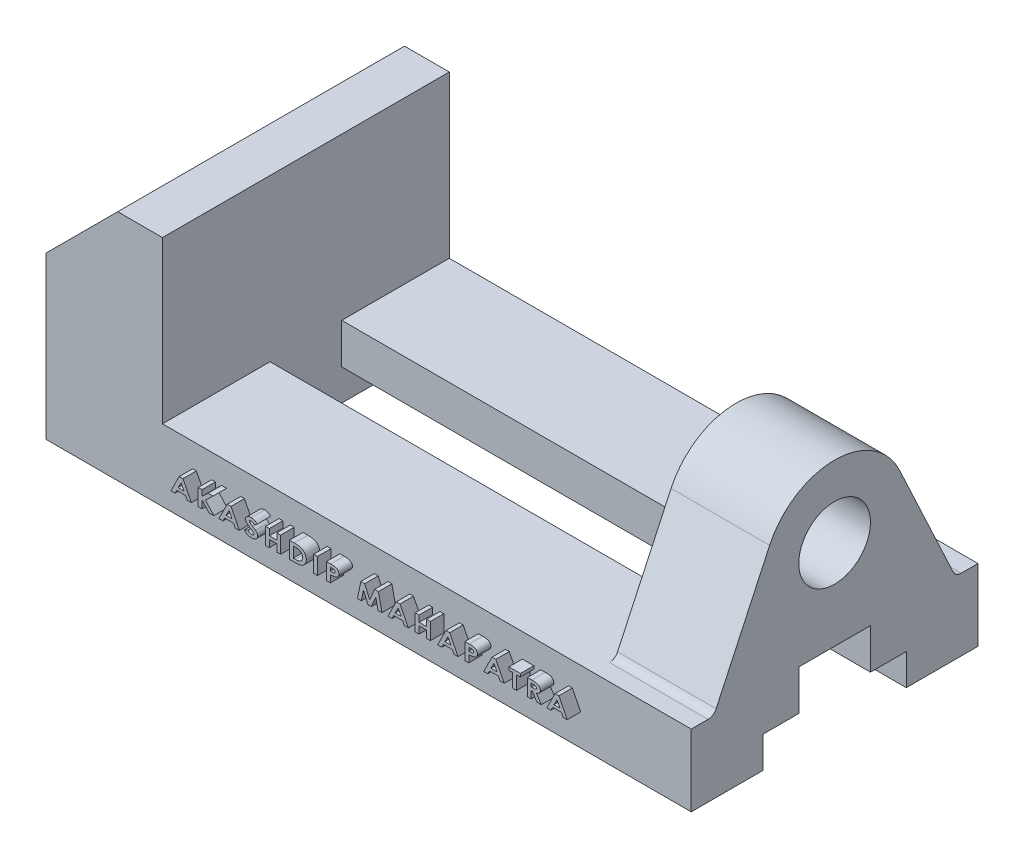
from build123d import *

# Parameters (mm, degrees)
BOSS_EXTRUDE1_DEPTH   = 144
BOSS_EXTRUDE1_2_DEPTH = 144
BOSS_EXTRUDE2_START   = 122
SKETCH1_3_R           = 8
BOSS_EXTRUDE2_DEPTH   = 22
SKETCH1_4_R           = 8
SKETCH1_4_W           = 16
SKETCH1_4_H           = 9
BOSS_EXTRUDE3_DEPTH   = 26
CHAMFER1_SIZE         = 16
FILLET1_R             = 2
LPATTERN1_COUNT       = 2
LPATTERN1_PITCH       = 70
LPATTERN1_COUNT_DIR2  = 2
LPATTERN1_PITCH_DIR2  = 44
WRAP1_OUTLINE_W       = 0.854807692
WRAP1_OUTLINE_H       = 3.704166667
WRAP1_DEPTH           = 3


# Read off the part's stored shape, not the designer's step: Wrap1
with BuildPart() as part:
    # Sketch1 → Boss-Extrude1 (new body)
    with BuildSketch(Plane(origin=(0, 0, 0), x_dir=(0, 0, -1), z_dir=(1, 0, 0))):
        Polygon((26.980199866, -10), (8, -10), (8, -19), (16, -19), (16, -26), (32, -26), (32, -10), align=None)
    extrude(amount=BOSS_EXTRUDE1_DEPTH)



with BuildPart() as body_2:
    # Sketch1 → Boss-Extrude1 2 (new body)
    with BuildSketch(Plane(origin=(0, 0, 0), x_dir=(0, 0, -1), z_dir=(1, 0, 0))):
        Polygon((-8, -10), (-26.980199866, -10), (-32, -10), (-32, -26), (-16, -26), (-16, -19), (-8, -19), align=None)
    extrude(amount=BOSS_EXTRUDE1_2_DEPTH)


with BuildPart() as part_1:
    add(part.part)

    add(body_2.part)  # Boss-Extrude2 merges body 2
    # Sketch1<3> → Boss-Extrude2 (add)
    with BuildSketch(Plane(origin=(0, 0, 0), x_dir=(0, 0, -1), z_dir=(1, 0, 0)).offset(BOSS_EXTRUDE2_START)):
        with BuildLine():
            Line((-14.500924593, 16.761892188), (-26.980199866, -10))
            Line((-26.980199866, -10), (-8, -10))
            Line((-8, -10), (8, -10))
            Line((8, -10), (26.980199866, -10))
            Line((26.980199866, -10), (14.500924593, 16.761892188))
            ThreePointArc((14.500924593, 16.761892188), (8.596793749, 23.494263123), (3.7e-08, 26))
            ThreePointArc((3.7e-08, 26), (-8.596793718, 23.494263143), (-14.500924593, 16.761892188))
        make_face()
        with Locations((0, 10)):
            Circle(SKETCH1_3_R, mode=Mode.SUBTRACT)
    extrude(amount=BOSS_EXTRUDE2_DEPTH)

    # Sketch1<4> → Boss-Extrude3 (add)
    # profile 1 of 6: a face of its own
    with BuildSketch(Plane(origin=(0, 0, 0), x_dir=(0, 0, -1), z_dir=(1, 0, 0))):
        with BuildLine():
            Line((-14.500924593, 16.761892188), (-26.980199866, -10))
            Line((-26.980199866, -10), (-8, -10))
            Line((-8, -10), (8, -10))
            Line((8, -10), (26.980199866, -10))
            Line((26.980199866, -10), (14.500924593, 16.761892188))
            ThreePointArc((14.500924593, 16.761892188), (8.596793749, 23.494263123), (3.7e-08, 26))
            ThreePointArc((3.7e-08, 26), (-8.596793718, 23.494263143), (-14.500924593, 16.761892188))
        make_face()
        with Locations((0, 10)):
            Circle(SKETCH1_4_R, mode=Mode.SUBTRACT)
    # profile 2 of 6: a face of its own
    with BuildSketch(Plane(origin=(0, 0, 0), x_dir=(0, 0, -1), z_dir=(1, 0, 0))):
        with BuildLine():
            Line((32, 26), (3.7e-08, 26))
            ThreePointArc((3.7e-08, 26), (8.596793749, 23.494263123), (14.500924593, 16.761892188))
            Line((14.500924593, 16.761892188), (26.980199866, -10))
            Line((26.980199866, -10), (32, -10))
            Line((32, -10), (32, 26))
        make_face()
    # profile 3 of 6: a face of its own
    with BuildSketch(Plane(origin=(0, 0, 0), x_dir=(0, 0, -1), z_dir=(1, 0, 0))):
        with BuildLine():
            Line((-32, -10), (-26.980199866, -10))
            Line((-26.980199866, -10), (-14.500924593, 16.761892188))
            ThreePointArc((-14.500924593, 16.761892188), (-8.596793718, 23.494263143), (3.7e-08, 26))
            Line((3.7e-08, 26), (-32, 26))
            Line((-32, 26), (-32, -10))
        make_face()
    # profile 4 of 6: a face of its own
    with BuildSketch(Plane(origin=(0, 0, 0), x_dir=(0, 0, -1), z_dir=(1, 0, 0))):
        with Locations((0, -14.5)):
            Rectangle(SKETCH1_4_W, SKETCH1_4_H)
    # profile 5 of 6: a face of its own
    with BuildSketch(Plane(origin=(0, 0, 0), x_dir=(0, 0, -1), z_dir=(1, 0, 0))):
        Polygon((8, -19), (-8, -19), (-16, -19), (-16, -26), (16, -26), (16, -19), align=None)
    # profile 6 of 6: a face of its own
    with BuildSketch(Plane(origin=(0, 0, 0), x_dir=(0, 0, -1), z_dir=(1, 0, 0))):
        with Locations((0, 10)):
            Circle(SKETCH1_4_R)
    extrude(amount=BOSS_EXTRUDE3_DEPTH)

    # Chamfer1
    chamfer1_edges = [part_1.edges().sort_by_distance(p)[0] for p in [
        (0, 26, 0),
    ]]
    chamfer(chamfer1_edges, length=CHAMFER1_SIZE)

    # Fillet1
    fillet1_edges = [part_1.edges().sort_by_distance(p)[0] for p in [
        (133, -10, 26.980199866),
        (133, -10, -26.980199866),
    ]]
    fillet(fillet1_edges, radius=FILLET1_R)

    # Sketch4 → M6x1.0 Tapped Hole1 (revolve, cut)
    with BuildSketch(Plane(origin=(106, -26, -22), x_dir=(0, 0, -1), z_dir=(1, 0, 0))):
        Polygon((0, 0), (0, 11.502151548), (2.5, 10), (2.5, 0), align=None)
    m6x1_0_tapped_hole1 = revolve(axis=Axis((106, -32.35, -22), (0, 1, 0)), mode=Mode.SUBTRACT)

    # LPattern1: M6x1.0 Tapped Hole1 2 × 2
    with Locations(*[(-i * LPATTERN1_PITCH, 0, j * LPATTERN1_PITCH_DIR2) for i in range(LPATTERN1_COUNT) for j in range(LPATTERN1_COUNT_DIR2) if (i, j) != (0, 0)]):
        add(m6x1_0_tapped_hole1, mode=Mode.SUBTRACT)

    # Wrap1 outline → Wrap1 (add)
    # profile 1 of 17: a face of its own
    with BuildSketch(Plane.XY.offset(32)):
        with BuildLine():
            add(Edge.make_bspline(
                [(49.491506657, -16.264982993), (49.462997763, -16.234870068), (49.407860805, -16.176630871), (49.32066963, -16.098994351), (49.233060059, -16.033396076), (49.145100444, -15.979243306), (49.056323415, -15.93715398), (48.966896606, -15.907381505), (48.877156949, -15.888558524), (48.817097644, -15.886225053), (48.78732914, -15.885068463)],
                knots=[0, 0, 0, 0, 0.150958661, 0.291958057, 0.424544558, 0.549052631, 0.667513603, 0.781446696, 0.891673652, 1, 1, 1, 1], degree=3))
            Line((49.491506657, -16.264982993), (50.148194858, -15.810124386))
            add(Edge.make_bspline(
                [(48.808847736, -15.220218036), (48.866067551, -15.221805712), (48.979518078, -15.224953621), (49.147237251, -15.24957773), (49.310849741, -15.288786777), (49.443865549, -15.335548015), (49.549569543, -15.381723413), (49.630556802, -15.423451949), (49.712791292, -15.472256023), (49.797748493, -15.525811035), (49.88270271, -15.588317012), (49.970503006, -15.655530806), (50.059585754, -15.72983719), (50.118206643, -15.782952576), (50.148194858, -15.810124386)],
                knots=[0, 0, 0, 0, 0.114222249, 0.226470051, 0.337758597, 0.449758371, 0.507480247, 0.56800576, 0.631537887, 0.698398273, 0.768446333, 0.842045394, 0.919196437, 1, 1, 1, 1], degree=3))
            add(Edge.make_bspline(
                [(47.536282465, -16.159616073), (47.537427776, -16.127871672), (47.539690554, -16.065154595), (47.557639617, -15.973000873), (47.585345569, -15.883779472), (47.627182847, -15.799142244), (47.678722518, -15.717199356), (47.742344732, -15.639358926), (47.817084743, -15.564685132), (47.902743374, -15.495192342), (47.996379927, -15.430875604), (48.096639203, -15.374358844), (48.202604143, -15.326931952), (48.313409152, -15.287341456), (48.42962162, -15.256981232), (48.551201012, -15.235506683), (48.678230835, -15.222873013), (48.764792765, -15.221113517), (48.808847736, -15.220218036)],
                knots=[0, 0, 0, 0, 0.054345475, 0.107369781, 0.16030427, 0.213939686, 0.268604717, 0.325849812, 0.385776716, 0.449311953, 0.514544253, 0.580192255, 0.646193517, 0.713207231, 0.781556748, 0.85171219, 0.924530159, 1, 1, 1, 1], degree=3))
            add(Edge.make_bspline(
                [(48.749486091, -17.459636105), (48.688268321, -17.419756242), (48.570948332, -17.343329003), (48.404478555, -17.230604169), (48.255157277, -17.124651783), (48.123020407, -17.025421754), (48.007842617, -16.933222941), (47.90853841, -16.849449876), (47.827426003, -16.771235707), (47.760701363, -16.699526241), (47.707342786, -16.630343856), (47.66109651, -16.563431366), (47.623867053, -16.495528188), (47.590979729, -16.428700477), (47.566638882, -16.361204809), (47.549489142, -16.293840711), (47.538603713, -16.226749794), (47.537053524, -16.181916165), (47.536282465, -16.159616073)],
                knots=[0, 0, 0, 0, 0.118699559, 0.22748021, 0.326606583, 0.416137866, 0.495902898, 0.566294685, 0.627112883, 0.678877674, 0.725259051, 0.768949452, 0.810868681, 0.850950612, 0.889848742, 0.927177123, 0.963778152, 1, 1, 1, 1], degree=3))
            add(Edge.make_bspline(
                [(49.388365798, -18.098515812), (49.386889247, -18.077297144), (49.383857602, -18.033731127), (49.359487509, -17.969679139), (49.322481421, -17.90561504), (49.278980477, -17.853624814), (49.234263771, -17.810571707), (49.191711335, -17.772371657), (49.139825225, -17.730462461), (49.078704715, -17.684525583), (49.008962804, -17.63438484), (48.931056405, -17.578978177), (48.843272163, -17.520777769), (48.781667969, -17.480616338), (48.749486091, -17.459636105)],
                knots=[0, 0, 0, 0, 0.067943983, 0.139502096, 0.217390018, 0.304805441, 0.355891195, 0.416610267, 0.488273987, 0.569884028, 0.661986168, 0.763963189, 0.876694953, 1, 1, 1, 1], degree=3))
            add(Edge.make_bspline(
                [(48.84075462, -18.44949154), (48.877962833, -18.448328012), (48.949989021, -18.446075699), (49.053074065, -18.425411341), (49.147590374, -18.393396805), (49.229496605, -18.34647859), (49.29867668, -18.293010934), (49.350007578, -18.233102242), (49.382956482, -18.167580192), (49.386575789, -18.121370067), (49.388365798, -18.098515812)],
                knots=[0, 0, 0, 0, 0.156372757, 0.302700202, 0.440600159, 0.574322046, 0.697997564, 0.806585982, 0.904342756, 1, 1, 1, 1], degree=3))
            add(Edge.make_bspline(
                [(48.055696861, -17.974598378), (48.083913987, -18.012296853), (48.138575211, -18.085325013), (48.229729795, -18.181584957), (48.32267907, -18.264897893), (48.420229933, -18.331623315), (48.520567047, -18.38481008), (48.624506388, -18.421942382), (48.73163001, -18.445294387), (48.804278515, -18.448088596), (48.84075462, -18.44949154)],
                knots=[0, 0, 0, 0, 0.14789083, 0.286488915, 0.415934943, 0.539495035, 0.657026207, 0.771865439, 0.885455863, 1, 1, 1, 1], degree=3))
            Line((48.055696861, -17.974598378), (47.298835884, -18.325574106))
            add(Edge.make_bspline(
                [(48.805879654, -19.114341968), (48.764804487, -19.113793708), (48.684039126, -19.112715674), (48.564900054, -19.103556383), (48.449708762, -19.088833498), (48.338425116, -19.068193389), (48.231147288, -19.041366039), (48.127963297, -19.008893098), (48.028878507, -18.970058986), (47.933482975, -18.925593713), (47.841968161, -18.874237284), (47.754117381, -18.815964451), (47.669424865, -18.751454756), (47.588125082, -18.679763879), (47.510580484, -18.601162688), (47.435914634, -18.516011262), (47.364558788, -18.424223406), (47.320941676, -18.358754638), (47.298835884, -18.325574106)],
                knots=[0, 0, 0, 0, 0.069079596, 0.135829965, 0.200847866, 0.264328967, 0.326079771, 0.386734776, 0.44614432, 0.50495509, 0.563627381, 0.622473456, 0.682133011, 0.742559312, 0.804630205, 0.867717485, 0.932957279, 1, 1, 1, 1], degree=3))
            add(Edge.make_bspline(
                [(50.243173491, -18.059930743), (50.242220416, -18.097374237), (50.240345046, -18.171051989), (50.219871235, -18.27880867), (50.189055718, -18.381532176), (50.145564976, -18.479540121), (50.088283416, -18.571612339), (50.020057634, -18.659841616), (49.937863509, -18.741672854), (49.845013605, -18.818276795), (49.741923514, -18.8878857), (49.63041452, -18.948821359), (49.511328386, -18.999942168), (49.384691456, -19.041768729), (49.250595902, -19.073943693), (49.109071775, -19.097769591), (48.96002295, -19.112100781), (48.858100636, -19.113582694), (48.805879654, -19.114341968)],
                knots=[0, 0, 0, 0, 0.056434847, 0.111047135, 0.164883648, 0.218011755, 0.272291459, 0.328134543, 0.385930226, 0.446905296, 0.509531335, 0.573332937, 0.63836384, 0.704810145, 0.774329817, 0.846239791, 0.92121932, 1, 1, 1, 1], degree=3))
            add(Edge.make_bspline(
                [(49.745277691, -17.210317195), (49.787636114, -17.24555363), (49.868329302, -17.312679363), (49.974659465, -17.418073071), (50.062263707, -17.52075547), (50.130640935, -17.623002032), (50.181267747, -17.726758905), (50.217785173, -17.833538722), (50.238553429, -17.94534847), (50.24162439, -18.021511455), (50.243173491, -18.059930743)],
                knots=[0, 0, 0, 0, 0.161610153, 0.307868829, 0.438705892, 0.557063796, 0.667745359, 0.776530934, 0.887274346, 1, 1, 1, 1], degree=3))
            add(Edge.make_bspline(
                [(49.125690518, -16.782913348), (49.16628074, -16.809833699), (49.243116461, -16.86079288), (49.351906997, -16.933819988), (49.448022609, -16.999017054), (49.532173251, -17.055963982), (49.603168438, -17.105781168), (49.662093794, -17.14716014), (49.708061738, -17.181127744), (49.734182347, -17.201614825), (49.745277691, -17.210317195)],
                knots=[0, 0, 0, 0, 0.194085623, 0.367396574, 0.522122062, 0.656895355, 0.772279406, 0.867721118, 0.943811435, 1, 1, 1, 1], degree=3))
            add(Edge.make_bspline(
                [(48.471228378, -16.305052104), (48.482470293, -16.31584161), (48.508547651, -16.340869536), (48.557066966, -16.379563512), (48.617497289, -16.428483512), (48.693550957, -16.48295167), (48.781607911, -16.547543131), (48.884612484, -16.618075788), (48.999893065, -16.69876769), (49.082296273, -16.753887027), (49.125690518, -16.782913348)],
                knots=[0, 0, 0, 0, 0.057608318, 0.133631395, 0.229362006, 0.345190875, 0.479516157, 0.633313801, 0.806899863, 1, 1, 1, 1], degree=3))
            add(Edge.make_bspline(
                [(48.391090157, -16.127709189), (48.392173174, -16.143156908), (48.394370471, -16.174498272), (48.410063292, -16.220559984), (48.435787516, -16.264974602), (48.459098266, -16.29133504), (48.471228378, -16.305052104)],
                knots=[0, 0, 0, 0, 0.232325279, 0.471357019, 0.724912389, 1, 1, 1, 1], degree=3))
            add(Edge.make_bspline(
                [(48.78732914, -15.885068463), (48.759564918, -15.885800625), (48.706117316, -15.887210074), (48.629790578, -15.901342709), (48.561422867, -15.925084644), (48.502242662, -15.957320243), (48.454518084, -15.995530664), (48.417544873, -16.035894239), (48.395096226, -16.080896189), (48.392399698, -16.112406523), (48.391090157, -16.127709189)],
                knots=[0, 0, 0, 0, 0.163624331, 0.314985536, 0.455708752, 0.58890329, 0.710338001, 0.814775027, 0.910047421, 1, 1, 1, 1], degree=3))
        make_face()
    # profile 2 of 17: a face of its own
    with BuildSketch(Plane.XY.offset(32)):
        with BuildLine():
            add(Edge.make_bspline(
                [(58.414600774, -15.315196668), (58.497965261, -15.31565234), (58.659065735, -15.316532917), (58.892404317, -15.326476109), (59.108959167, -15.341697157), (59.309043507, -15.362810971), (59.492611177, -15.390639939), (59.659810648, -15.425380596), (59.810664094, -15.465653785), (59.946745765, -15.512730248), (60.07092012, -15.568331874), (60.188630066, -15.629522295), (60.300084517, -15.699860075), (60.406695137, -15.777121217), (60.507783101, -15.862543351), (60.602793376, -15.956275845), (60.691946687, -16.057704329), (60.775784857, -16.165615133), (60.851969407, -16.279875465), (60.918540432, -16.399871333), (60.973864701, -16.525008148), (61.02074416, -16.654407659), (61.05468125, -16.789359717), (61.081419437, -16.928206804), (61.096079253, -17.072233014), (61.098169775, -17.169723286), (61.099231183, -17.219221441)],
                knots=[0, 0, 0, 0, 0.066843146, 0.12917326, 0.18723626, 0.240897148, 0.290461912, 0.336050185, 0.37776348, 0.415587011, 0.451371808, 0.486769224, 0.521878201, 0.55694738, 0.592271376, 0.627894219, 0.663866496, 0.700483098, 0.73739341, 0.773879254, 0.810368872, 0.847004268, 0.88409319, 0.921825612, 0.960308983, 1, 1, 1, 1], degree=3))
            Line((58.414600774, -15.315196668), (57.3475752, -15.315196668))
            Line((57.3475752, -15.315196668), (57.3475752, -19.019363335))
            Line((57.3475752, -19.019363335), (58.430925227, -19.019363335))
            add(Edge.make_bspline(
                [(61.099231183, -17.219221441), (61.098612157, -17.254605859), (61.097389774, -17.324478964), (61.089115549, -17.428305507), (61.075089709, -17.529902375), (61.055099609, -17.629548675), (61.028889627, -17.726801656), (60.997765975, -17.822300416), (60.960693717, -17.915409234), (60.918430839, -18.00615287), (60.870676762, -18.093607065), (60.819213914, -18.178200835), (60.762339381, -18.258276152), (60.702303304, -18.335356193), (60.637047161, -18.407703107), (60.567440298, -18.476299112), (60.494351884, -18.541791504), (60.390573442, -18.622116531), (60.255173222, -18.71273614), (60.084663052, -18.804678989), (59.90712631, -18.877829926), (59.751439666, -18.923654172), (59.616057729, -18.952598926), (59.496960871, -18.969385444), (59.361166235, -18.985205338), (59.208173759, -18.997136807), (59.038018371, -19.00800961), (58.8506901, -19.013804484), (58.646384229, -19.018695397), (58.504636381, -19.019134825), (58.430925227, -19.019363335)],
                knots=[0, 0, 0, 0, 0.028928171, 0.057124046, 0.085092767, 0.11273427, 0.14015372, 0.167395124, 0.194807116, 0.22203726, 0.249182426, 0.276234035, 0.302938774, 0.329435991, 0.356070201, 0.382523399, 0.409308408, 0.436248684, 0.489753398, 0.542317841, 0.594365535, 0.646448572, 0.674766006, 0.7074825, 0.744730849, 0.786528911, 0.832922789, 0.884115749, 0.939738331, 1, 1, 1, 1], degree=3))
        make_face()
        with BuildLine():
            add(Edge.make_bspline(
                [(58.640917047, -18.354512908), (58.693116337, -18.354431413), (58.793842262, -18.354274158), (58.939256678, -18.347375841), (59.073756576, -18.34041116), (59.196897031, -18.327136833), (59.309078965, -18.312721996), (59.409547148, -18.29175727), (59.499789994, -18.270764794), (59.579654338, -18.243264985), (59.652595352, -18.212312786), (59.720717451, -18.176648804), (59.78580367, -18.136377358), (59.847292941, -18.091158099), (59.905315575, -18.041035043), (59.960610835, -17.986950894), (60.011850859, -17.92708828), (60.059678481, -17.862896788), (60.104168109, -17.79492374), (60.140627778, -17.721750597), (60.172986602, -17.645550055), (60.199844161, -17.56554851), (60.21969484, -17.48128665), (60.233534163, -17.393210697), (60.242814494, -17.301535316), (60.243882251, -17.239031761), (60.244423491, -17.207349112)],
                knots=[0, 0, 0, 0, 0.069208905, 0.133548384, 0.193024024, 0.247755054, 0.297758134, 0.342913613, 0.383801954, 0.420519209, 0.454757611, 0.48879275, 0.522377663, 0.55616218, 0.589887736, 0.6239813, 0.658631964, 0.69425169, 0.730098712, 0.766183526, 0.802489762, 0.839828748, 0.877934867, 0.917136137, 0.957996843, 1, 1, 1, 1], degree=3))
            Line((58.640917047, -18.354512908), (58.202382892, -18.354512908))
            Line((58.202382892, -18.354512908), (58.202382892, -15.980047096))
            Line((58.202382892, -15.980047096), (58.522935777, -15.980047096))
            add(Edge.make_bspline(
                [(59.802179233, -16.276855322), (59.767132116, -16.252645785), (59.694623916, -16.202559211), (59.570496251, -16.143835162), (59.432838303, -16.092323787), (59.279640439, -16.051404937), (59.111807281, -16.018843736), (58.928806383, -15.996642815), (58.730937295, -15.982120016), (58.593950593, -15.980754822), (58.522935777, -15.980047096)],
                knots=[0, 0, 0, 0, 0.095660318, 0.197909504, 0.307745783, 0.425960963, 0.554040151, 0.69196668, 0.840313481, 1, 1, 1, 1], degree=3))
            add(Edge.make_bspline(
                [(60.244423491, -17.207349112), (60.243258328, -17.158794173), (60.240982041, -17.063936161), (60.219776538, -16.925759195), (60.184830858, -16.795880473), (60.136737466, -16.673967754), (60.073867384, -16.5611107), (59.997016465, -16.457040264), (59.907334191, -16.360187822), (59.83759226, -16.304919202), (59.802179233, -16.276855322)],
                knots=[0, 0, 0, 0, 0.135919198, 0.26553478, 0.390390601, 0.511953322, 0.631652301, 0.751086387, 0.873608539, 1, 1, 1, 1], degree=3))
        make_face(mode=Mode.SUBTRACT)
    # profile 3 of 17: a face of its own
    with BuildSketch(Plane.XY.offset(32)):
        with BuildLine():
            add(Edge.make_bspline(
                [(66.543732886, -15.315196668), (66.605818493, -15.315411368), (66.725561527, -15.315825454), (66.898514621, -15.320937882), (67.058071376, -15.329963684), (67.204146054, -15.341234689), (67.336749193, -15.357061417), (67.455977476, -15.374952561), (67.561846885, -15.396968836), (67.655526804, -15.423183182), (67.739971686, -15.453740103), (67.819300799, -15.486605341), (67.893013121, -15.525816486), (67.963680146, -15.56695381), (68.02864752, -15.613831754), (68.089276538, -15.664807038), (68.145827475, -15.719422158), (68.196968417, -15.778974661), (68.242750656, -15.841822588), (68.283443698, -15.90757373), (68.317412692, -15.976758567), (68.345859434, -16.048857406), (68.367516577, -16.124150616), (68.381834891, -16.202739997), (68.39217895, -16.284002813), (68.393116536, -16.339398654), (68.393590157, -16.367381831)],
                knots=[0, 0, 0, 0, 0.077296154, 0.149079252, 0.215390048, 0.276254581, 0.33144859, 0.381621573, 0.426314706, 0.465991585, 0.502614802, 0.538076418, 0.572785299, 0.606479389, 0.63980702, 0.672374816, 0.70504001, 0.737572846, 0.769971321, 0.8017656, 0.833716081, 0.865796887, 0.898155824, 0.931071174, 0.965180643, 1, 1, 1, 1], degree=3))
            Line((66.543732886, -15.315196668), (65.591720499, -15.315196668))
            Line((65.591720499, -15.315196668), (65.591720499, -19.019363335))
            Line((65.591720499, -19.019363335), (66.446528191, -19.019363335))
            Line((66.446528191, -19.019363335), (66.446528191, -17.404726583))
            add(Edge.make_bspline(
                [(67.413380989, -17.34833302), (67.388938799, -17.353062207), (67.335843708, -17.363335289), (67.24878372, -17.373626757), (67.148347885, -17.383296405), (67.034296607, -17.39144121), (66.906615639, -17.397010331), (66.765373159, -17.401402658), (66.610528687, -17.404552885), (66.502676121, -17.404667115), (66.446528191, -17.404726583)],
                knots=[0, 0, 0, 0, 0.076992595, 0.167248878, 0.271023112, 0.389157746, 0.520907297, 0.666359895, 0.826307321, 1, 1, 1, 1], degree=3))
            add(Edge.make_bspline(
                [(68.393590157, -16.367381831), (68.392620472, -16.39833091), (68.390712732, -16.459219568), (68.379075148, -16.548598159), (68.357987438, -16.633802407), (68.328970162, -16.715136111), (68.291812687, -16.792573525), (68.246116418, -16.866039637), (68.191741375, -16.934842128), (68.129669965, -16.999697207), (68.060945771, -17.059978752), (67.986341571, -17.116294342), (67.905021236, -17.166481254), (67.818164184, -17.212366587), (67.725574845, -17.254256983), (67.627133525, -17.291012612), (67.52267086, -17.323442504), (67.450360379, -17.339911049), (67.413380989, -17.34833302)],
                knots=[0, 0, 0, 0, 0.061452874, 0.120901275, 0.178545667, 0.235393938, 0.292059519, 0.348744246, 0.406801297, 0.465846764, 0.526731968, 0.58811417, 0.65120122, 0.716223256, 0.783035972, 0.852809367, 0.924727098, 1, 1, 1, 1], degree=3))
        make_face()
        with BuildLine():
            add(Edge.make_bspline(
                [(66.747788541, -16.739876156), (66.776233167, -16.739675579), (66.830899991, -16.739290096), (66.909570691, -16.737989521), (66.98133699, -16.735213716), (67.046359946, -16.730439486), (67.104594216, -16.725819169), (67.156234236, -16.718737442), (67.201214496, -16.711968179), (67.251335029, -16.70004871), (67.306192928, -16.681806985), (67.364969903, -16.653214054), (67.416683825, -16.61935428), (67.460313674, -16.57872969), (67.495684376, -16.532882893), (67.520400449, -16.481264754), (67.535857968, -16.42540354), (67.537792634, -16.386529101), (67.538782465, -16.366639811)],
                knots=[0, 0, 0, 0, 0.087017856, 0.167236862, 0.240694134, 0.306678908, 0.366688329, 0.419339316, 0.46611096, 0.505753849, 0.576818402, 0.64246828, 0.705215376, 0.765177077, 0.824045101, 0.881235909, 0.939236846, 1, 1, 1, 1], degree=3))
            Line((66.747788541, -16.739876156), (66.446528191, -16.739876156))
            Line((66.446528191, -16.739876156), (66.446528191, -15.980047096))
            Line((66.446528191, -15.980047096), (66.713655595, -15.980047096))
            add(Edge.make_bspline(
                [(67.315434274, -16.053507132), (67.300443825, -16.047534198), (67.268270618, -16.034714807), (67.214222359, -16.02037425), (67.152004136, -16.007966442), (67.081155047, -15.997691894), (67.001680201, -15.98976044), (66.913344227, -15.983686547), (66.816314283, -15.981257218), (66.748778115, -15.980461114), (66.713655595, -15.980047096)],
                knots=[0, 0, 0, 0, 0.079352001, 0.170309001, 0.274627017, 0.391510308, 0.522437574, 0.667611812, 0.82713987, 1, 1, 1, 1], degree=3))
            add(Edge.make_bspline(
                [(67.538782465, -16.366639811), (67.538059733, -16.349270717), (67.536652247, -16.315445245), (67.525985779, -16.266640814), (67.508744853, -16.221228541), (67.484263636, -16.179272525), (67.451593991, -16.142161073), (67.412995087, -16.108224382), (67.367656033, -16.077387233), (67.333266527, -16.061661511), (67.315434274, -16.053507132)],
                knots=[0, 0, 0, 0, 0.127009453, 0.247344791, 0.363638272, 0.481275906, 0.600627337, 0.723721013, 0.856738953, 1, 1, 1, 1], degree=3))
        make_face(mode=Mode.SUBTRACT)
    # profile 4 of 17: a face of its own
    with BuildSketch(Plane.XY.offset(32)):
        with BuildLine():
            add(Edge.make_bspline(
                [(97.449779894, -15.315196668), (97.511865502, -15.315411368), (97.631608535, -15.315825454), (97.804561629, -15.320937882), (97.964118384, -15.329963684), (98.110193062, -15.341234689), (98.242796202, -15.357061417), (98.362024485, -15.374952561), (98.467893893, -15.396968836), (98.561573812, -15.423183182), (98.646018694, -15.453740103), (98.725347808, -15.486605341), (98.799060129, -15.525816486), (98.869727155, -15.56695381), (98.934694529, -15.613831754), (98.995323546, -15.664807038), (99.051874484, -15.719422158), (99.103015426, -15.778974661), (99.148797664, -15.841822588), (99.189490706, -15.90757373), (99.223459701, -15.976758567), (99.251906443, -16.048857406), (99.273563586, -16.124150616), (99.2878819, -16.202739997), (99.298225959, -16.284002813), (99.299163545, -16.339398654), (99.299637166, -16.367381831)],
                knots=[0, 0, 0, 0, 0.077296154, 0.149079252, 0.215390048, 0.276254581, 0.33144859, 0.381621573, 0.426314706, 0.465991585, 0.502614802, 0.538076418, 0.572785299, 0.606479389, 0.63980702, 0.672374816, 0.70504001, 0.737572846, 0.769971321, 0.8017656, 0.833716081, 0.865796887, 0.898155824, 0.931071174, 0.965180643, 1, 1, 1, 1], degree=3))
            Line((97.449779894, -15.315196668), (96.497767508, -15.315196668))
            Line((96.497767508, -15.315196668), (96.497767508, -19.019363335))
            Line((96.497767508, -19.019363335), (97.3525752, -19.019363335))
            Line((97.3525752, -19.019363335), (97.3525752, -17.404726583))
            add(Edge.make_bspline(
                [(98.319427998, -17.34833302), (98.294985808, -17.353062207), (98.241890716, -17.363335289), (98.154830729, -17.373626757), (98.054394893, -17.383296405), (97.940343615, -17.39144121), (97.812662647, -17.397010331), (97.671420168, -17.401402658), (97.516575695, -17.404552885), (97.408723129, -17.404667115), (97.3525752, -17.404726583)],
                knots=[0, 0, 0, 0, 0.076992595, 0.167248878, 0.271023112, 0.389157746, 0.520907297, 0.666359895, 0.826307321, 1, 1, 1, 1], degree=3))
            add(Edge.make_bspline(
                [(99.299637166, -16.367381831), (99.298667481, -16.39833091), (99.29675974, -16.459219568), (99.285122157, -16.548598159), (99.264034447, -16.633802407), (99.23501717, -16.715136111), (99.197859695, -16.792573525), (99.152163427, -16.866039637), (99.097788384, -16.934842128), (99.035716973, -16.999697207), (98.96699278, -17.059978752), (98.892388579, -17.116294342), (98.811068245, -17.166481254), (98.724211193, -17.212366587), (98.631621853, -17.254256983), (98.533180534, -17.291012612), (98.428717869, -17.323442504), (98.356407387, -17.339911049), (98.319427998, -17.34833302)],
                knots=[0, 0, 0, 0, 0.061452874, 0.120901275, 0.178545667, 0.235393938, 0.292059519, 0.348744246, 0.406801297, 0.465846764, 0.526731968, 0.58811417, 0.65120122, 0.716223256, 0.783035972, 0.852809367, 0.924727098, 1, 1, 1, 1], degree=3))
        make_face()
        with BuildLine():
            add(Edge.make_bspline(
                [(97.65383555, -16.739876156), (97.682280175, -16.739675579), (97.736947, -16.739290096), (97.815617699, -16.737989521), (97.887383999, -16.735213716), (97.952406954, -16.730439486), (98.010641225, -16.725819169), (98.062281245, -16.718737442), (98.107261504, -16.711968179), (98.157382037, -16.70004871), (98.212239936, -16.681806985), (98.271016912, -16.653214054), (98.322730833, -16.61935428), (98.366360683, -16.57872969), (98.401731384, -16.532882893), (98.426447457, -16.481264754), (98.441904976, -16.42540354), (98.443839642, -16.386529101), (98.444829473, -16.366639811)],
                knots=[0, 0, 0, 0, 0.087017856, 0.167236862, 0.240694134, 0.306678908, 0.366688329, 0.419339316, 0.46611096, 0.505753849, 0.576818402, 0.64246828, 0.705215376, 0.765177077, 0.824045101, 0.881235909, 0.939236846, 1, 1, 1, 1], degree=3))
            Line((97.65383555, -16.739876156), (97.3525752, -16.739876156))
            Line((97.3525752, -16.739876156), (97.3525752, -15.980047096))
            Line((97.3525752, -15.980047096), (97.619702604, -15.980047096))
            add(Edge.make_bspline(
                [(98.221481283, -16.053507132), (98.206490834, -16.047534198), (98.174317626, -16.034714807), (98.120269368, -16.02037425), (98.058051144, -16.007966442), (97.987202056, -15.997691894), (97.907727209, -15.98976044), (97.819391235, -15.983686547), (97.722361291, -15.981257218), (97.654825124, -15.980461114), (97.619702604, -15.980047096)],
                knots=[0, 0, 0, 0, 0.079352001, 0.170309001, 0.274627017, 0.391510308, 0.522437574, 0.667611812, 0.82713987, 1, 1, 1, 1], degree=3))
            add(Edge.make_bspline(
                [(98.444829473, -16.366639811), (98.444106742, -16.349270717), (98.442699256, -16.315445245), (98.432032788, -16.266640814), (98.414791862, -16.221228541), (98.390310644, -16.179272525), (98.357640999, -16.142161073), (98.319042096, -16.108224382), (98.273703042, -16.077387233), (98.239313536, -16.061661511), (98.221481283, -16.053507132)],
                knots=[0, 0, 0, 0, 0.127009453, 0.247344791, 0.363638272, 0.481275906, 0.600627337, 0.723721013, 0.856738953, 1, 1, 1, 1], degree=3))
        make_face(mode=Mode.SUBTRACT)
    # profile 5 of 17: a face of its own
    with BuildSketch(Plane.XY.offset(32)):
        with BuildLine():
            add(Edge.make_bspline(
                [(111.415794184, -15.315196668), (111.480849248, -15.315381019), (111.60603542, -15.315735766), (111.786374257, -15.321215287), (111.952169596, -15.328959909), (112.103397674, -15.340572412), (112.240242691, -15.356138706), (112.362558283, -15.374434904), (112.470529729, -15.395272373), (112.565350813, -15.421085619), (112.650790744, -15.450542535), (112.730424068, -15.483889963), (112.805710234, -15.52198643), (112.877021889, -15.564138503), (112.94404172, -15.610976758), (113.006588934, -15.662557595), (113.06535996, -15.718113998), (113.119423063, -15.778179503), (113.168240186, -15.841567582), (113.211081245, -15.908281376), (113.247221814, -15.977855834), (113.277469491, -16.050147034), (113.299420252, -16.125714192), (113.315565303, -16.203617362), (113.326785024, -16.28444775), (113.327577504, -16.339393305), (113.327981183, -16.367381831)],
                knots=[0, 0, 0, 0, 0.079217145, 0.152438418, 0.219687052, 0.281319971, 0.337100027, 0.387364772, 0.431903269, 0.470920802, 0.506926148, 0.541888381, 0.575967612, 0.609595302, 0.642684521, 0.675426468, 0.708236229, 0.741079152, 0.773730926, 0.805563918, 0.837492239, 0.869094985, 0.900829505, 0.933141939, 0.965943403, 1, 1, 1, 1], degree=3))
            Line((111.415794184, -15.315196668), (110.431132892, -15.315196668))
            Line((110.431132892, -15.315196668), (110.431132892, -19.019363335))
            Line((110.431132892, -19.019363335), (111.285940585, -19.019363335))
            Line((111.285940585, -19.019363335), (111.285940585, -17.404726583))
            Line((111.285940585, -17.404726583), (111.533775454, -17.404726583))
            Line((111.533775454, -17.404726583), (112.582250514, -19.019363335))
            Line((112.582250514, -19.019363335), (113.541683106, -19.019363335))
            Line((113.541683106, -19.019363335), (112.443492668, -17.329040485))
            add(Edge.make_bspline(
                [(113.327981183, -16.367381831), (113.327242227, -16.396599821), (113.325790855, -16.453986397), (113.315146239, -16.538146032), (113.298175566, -16.61861707), (113.274364367, -16.695737211), (113.243314355, -16.769106079), (113.204815185, -16.8386353), (113.160671779, -16.905107324), (113.107774043, -16.966678429), (113.049488331, -17.025582741), (112.983210217, -17.07987823), (112.910800659, -17.13115361), (112.830513193, -17.177814614), (112.743853321, -17.22157862), (112.650089345, -17.261466922), (112.549599816, -17.298166702), (112.479488159, -17.31856695), (112.443492668, -17.329040485)],
                knots=[0, 0, 0, 0, 0.061734826, 0.121252363, 0.178970722, 0.235348059, 0.291560378, 0.347001876, 0.403107161, 0.459861253, 0.51825963, 0.578024547, 0.640673166, 0.705577353, 0.774069982, 0.845724766, 0.920794728, 1, 1, 1, 1], degree=3))
        make_face()
        with BuildLine():
            add(Edge.make_bspline(
                [(111.609461551, -16.739876156), (111.649036788, -16.739519823), (111.724742776, -16.738838171), (111.833669855, -16.735671725), (111.932875215, -16.727995082), (112.022465376, -16.718503819), (112.102670277, -16.707254832), (112.17291424, -16.691445567), (112.234255577, -16.674288102), (112.286390233, -16.653157797), (112.331061517, -16.629515677), (112.368822717, -16.601481125), (112.401038775, -16.570055925), (112.428243541, -16.535215007), (112.448457356, -16.495842561), (112.462224651, -16.45317979), (112.471737071, -16.407122375), (112.472682617, -16.375101189), (112.473173491, -16.358477585)],
                knots=[0, 0, 0, 0, 0.112356475, 0.21493385, 0.309286688, 0.394738588, 0.470706451, 0.53902324, 0.599016937, 0.651304087, 0.698433453, 0.742109523, 0.78431591, 0.825886694, 0.867028286, 0.909217147, 0.952870634, 1, 1, 1, 1], degree=3))
            Line((111.609461551, -16.739876156), (111.285940585, -16.739876156))
            Line((111.285940585, -16.739876156), (111.285940585, -15.980047096))
            Line((111.285940585, -15.980047096), (111.56865042, -15.980047096))
            add(Edge.make_bspline(
                [(112.473173491, -16.358477585), (112.472000697, -16.338818012), (112.469683351, -16.299972281), (112.452052201, -16.243820497), (112.422070918, -16.192481015), (112.381618671, -16.145718345), (112.33148939, -16.104301212), (112.273277654, -16.068627632), (112.207118526, -16.039608928), (112.145864516, -16.02119209), (112.089756301, -16.009588969), (112.039013705, -16.001526496), (111.980043472, -15.995202225), (111.913278267, -15.9890807), (111.838538125, -15.984860488), (111.7556624, -15.981872317), (111.664869078, -15.980650986), (111.601546721, -15.980253561), (111.56865042, -15.980047096)],
                knots=[0, 0, 0, 0, 0.054270107, 0.107233359, 0.160810444, 0.21752181, 0.277203081, 0.339799191, 0.405586307, 0.476288082, 0.516099722, 0.563854521, 0.618197743, 0.679952389, 0.749104348, 0.82501853, 0.909096197, 1, 1, 1, 1], degree=3))
        make_face(mode=Mode.SUBTRACT)
    # profile 6 of 17: a face of its own
    with BuildSketch(Plane.XY.offset(32)):
        Polygon((35.431255755, -19.019363335), (33.568042114, -15.315196668), (32.734753018, -15.315196668), (30.872281396, -19.019363335), (31.788676796, -19.019363335), (32.153750914, -18.259534275), (34.149044217, -18.259534275), (34.514860356, -19.019363335), align=None)
        Polygon((33.829975374, -17.594683848), (32.473561778, -17.594683848), (33.151768576, -16.308762207), align=None, mode=Mode.SUBTRACT)
    # profile 7 of 17: a face of its own
    with BuildSketch(Plane.XY.offset(32)):
        Polygon((39.404182271, -19.019363335), (40.455625414, -19.019363335), (38.56421499, -16.953578079), (40.287928766, -15.315196668), (39.18009206, -15.315196668), (37.819968362, -16.608538515), (37.819968362, -15.315196668), (36.96516067, -15.315196668), (36.96516067, -19.019363335), (37.819968362, -19.019363335), (37.819968362, -17.288971375), align=None)
    # profile 8 of 17: a face of its own
    with BuildSketch(Plane.XY.offset(32)):
        Polygon((45.2284501, -19.019363335), (46.144845499, -19.019363335), (44.281631857, -15.315196668), (43.448342761, -15.315196668), (41.58587114, -19.019363335), (42.502266539, -19.019363335), (42.867340658, -18.259534275), (44.862633961, -18.259534275), align=None)
        Polygon((44.543565117, -17.594683848), (43.187151522, -17.594683848), (43.86535832, -16.308762207), align=None, mode=Mode.SUBTRACT)
    # profile 9 of 17: a face of its own
    with BuildSketch(Plane.XY.offset(32)):
        Polygon((54.507714089, -19.019363335), (55.362521781, -19.019363335), (55.362521781, -15.315196668), (54.507714089, -15.315196668), (54.507714089, -16.739876156), (52.84558802, -16.739876156), (52.84558802, -15.315196668), (51.990780328, -15.315196668), (51.990780328, -19.019363335), (52.84558802, -19.019363335), (52.84558802, -17.404726583), (54.507714089, -17.404726583), align=None)
    # profile 10 of 17: a face of its own
    with BuildSketch(Plane.XY.offset(32)):
        with Locations((63.179263234, -17.167280001)):
            Rectangle(WRAP1_OUTLINE_W, WRAP1_OUTLINE_H)
    # profile 11 of 17: a face of its own
    with BuildSketch(Plane.XY.offset(32)):
        Polygon((77.10149831, -19.019363335), (77.967436311, -19.019363335), (77.195734922, -15.315196668), (76.34166925, -15.315196668), (75.236800627, -17.89891228), (74.137126148, -15.315196668), (73.277124312, -15.315196668), (72.506164943, -19.019363335), (73.372102944, -19.019363335), (73.859610456, -16.67977249), (74.856144077, -19.019363335), (75.613747075, -19.019363335), (76.613990798, -16.67977249), align=None)
    # profile 12 of 17: a face of its own
    with BuildSketch(Plane.XY.offset(32)):
        Polygon((82.95396292, -19.019363335), (83.87035832, -19.019363335), (82.007144678, -15.315196668), (81.173855582, -15.315196668), (79.311383961, -19.019363335), (80.22777936, -19.019363335), (80.592853478, -18.259534275), (82.588146781, -18.259534275), align=None)
        Polygon((82.269077938, -17.594683848), (80.912664343, -17.594683848), (81.59087114, -16.308762207), align=None, mode=Mode.SUBTRACT)
    # profile 13 of 17: a face of its own
    with BuildSketch(Plane.XY.offset(32)):
        Polygon((87.921196995, -19.019363335), (88.776004687, -19.019363335), (88.776004687, -15.315196668), (87.921196995, -15.315196668), (87.921196995, -16.739876156), (86.259070926, -16.739876156), (86.259070926, -15.315196668), (85.404263234, -15.315196668), (85.404263234, -19.019363335), (86.259070926, -19.019363335), (86.259070926, -17.404726583), (87.921196995, -17.404726583), align=None)
    # profile 14 of 17: a face of its own
    with BuildSketch(Plane.XY.offset(32)):
        Polygon((94.047467194, -19.019363335), (94.963862593, -19.019363335), (93.100648951, -15.315196668), (92.267359855, -15.315196668), (90.404888234, -19.019363335), (91.321283633, -19.019363335), (91.686357752, -18.259534275), (93.681651055, -18.259534275), align=None)
        Polygon((93.362582211, -17.594683848), (92.006168616, -17.594683848), (92.684375414, -16.308762207), align=None, mode=Mode.SUBTRACT)
    # profile 15 of 17: a face of its own
    with BuildSketch(Plane.XY.offset(32)):
        Polygon((104.333653091, -19.019363335), (105.250048491, -19.019363335), (103.386834849, -15.315196668), (102.553545753, -15.315196668), (100.691074132, -19.019363335), (101.607469531, -19.019363335), (101.972543649, -18.259534275), (103.967836952, -18.259534275), align=None)
        Polygon((103.648768109, -17.594683848), (102.292354513, -17.594683848), (102.970561311, -16.308762207), align=None, mode=Mode.SUBTRACT)
    # profile 16 of 17: a face of its own
    with BuildSketch(Plane.XY.offset(32)):
        Polygon((107.163867935, -19.019363335), (108.018675627, -19.019363335), (108.018675627, -15.980047096), (108.87348332, -15.980047096), (108.87348332, -15.315196668), (106.309060243, -15.315196668), (106.309060243, -15.980047096), (107.163867935, -15.980047096), align=None)
    # profile 17 of 17: a face of its own
    with BuildSketch(Plane.XY.offset(32)):
        Polygon((118.409486425, -19.019363335), (119.325881824, -19.019363335), (117.462668182, -15.315196668), (116.629379086, -15.315196668), (114.766907465, -19.019363335), (115.683302864, -19.019363335), (116.048376983, -18.259534275), (118.043670285, -18.259534275), align=None)
        Polygon((117.724601442, -17.594683848), (116.368187847, -17.594683848), (117.046394644, -16.308762207), align=None, mode=Mode.SUBTRACT)
    extrude(amount=WRAP1_DEPTH)


solid = part_1.part
